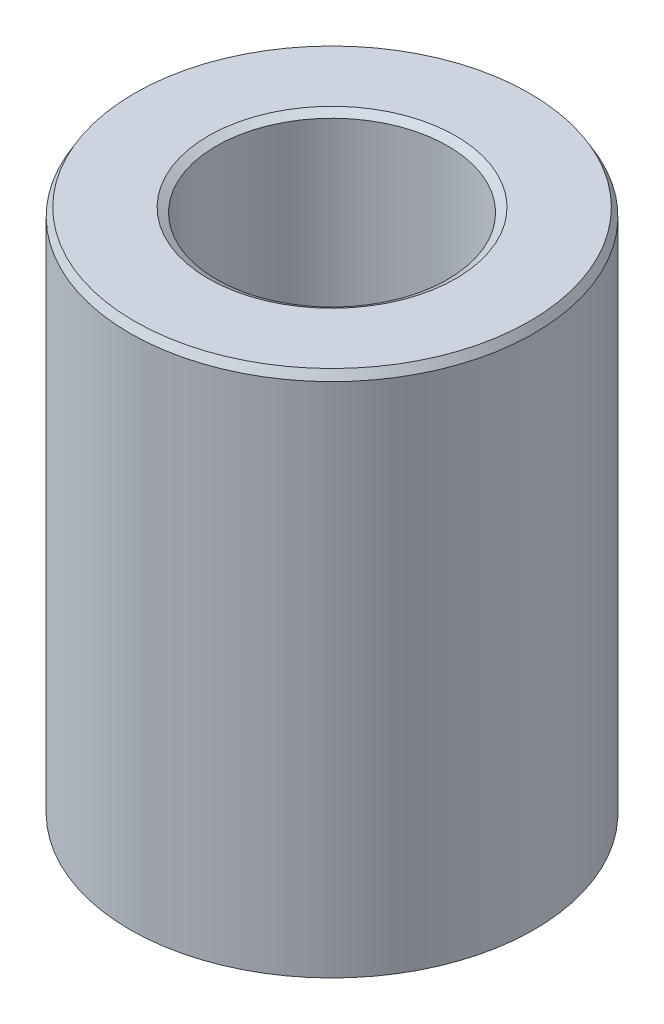
from build123d import *
from OCP.BRepFilletAPI import BRepFilletAPI_MakeChamfer

# Parameters (mm, degrees)
SKETCH1_R           = 35
BOSS_EXTRUDE1_DEPTH = 91.614825625
SKETCH2_R           = 20.023387625
CUT_EXTRUDE1_DEPTH  = 105.131053362
CHAMFER1_SIZE       = 1.395271686
CHAMFER1_SIZE2      = 0.805560484


with BuildPart() as part:
    # Sketch1 → Boss-Extrude1 (new body)
    with BuildSketch(Plane(origin=(0, 0, 0), x_dir=(1, 0, 0), z_dir=(0, 1, 0))):
        Circle(SKETCH1_R)
    extrude(amount=BOSS_EXTRUDE1_DEPTH)

    # Sketch2 → Cut-Extrude1 (cut, through all)
    with BuildSketch(Plane(origin=(0, 0, 0), x_dir=(1, 0, 0), z_dir=(0, 1, 0))):
        Circle(SKETCH2_R)
    extrude(amount=CUT_EXTRUDE1_DEPTH, mode=Mode.SUBTRACT)

    # Chamfer1: one chamfer whose edges measure the first distance from different faces: ONE call of the kernel's chamfer builder (chamfer() names one face for all edges)
    chamfer1_edges_1 = [part.edges().sort_by_distance(p)[0] for p in [
        (-20.023387625, 91.614825625, 0),
    ]]
    chamfer1_side_1 = [part.faces().sort_by_distance(p)[0] for p in [
        (-34.010050506, 91.614825625, 0),
    ]]
    chamfer1_edges_2 = [part.edges().sort_by_distance(p)[0] for p in [
        (-20.023387625, 0, 0),
    ]]
    chamfer1_side_2 = [part.faces().sort_by_distance(p)[0] for p in [
        (-20.023387625, 45.807412813, 0),
    ]]
    chamfer1_edges_3 = [part.edges().sort_by_distance(p)[0] for p in [
        (-35, 0, 0),
    ]]
    chamfer1_side_3 = [part.faces().sort_by_distance(p)[0] for p in [
        (-34.010050506, 0, 0),
    ]]
    chamfer1_edges_4 = [part.edges().sort_by_distance(p)[0] for p in [
        (-35, 91.614825625, 0),
    ]]
    chamfer1_side_4 = [part.faces().sort_by_distance(p)[0] for p in [
        (-35, 45.807412813, 0),
    ]]
    chamfer1 = BRepFilletAPI_MakeChamfer(part.part.solid().wrapped)
    for e in chamfer1_edges_1:
        chamfer1.Add(CHAMFER1_SIZE, CHAMFER1_SIZE2, e.wrapped, chamfer1_side_1[0].wrapped)  # the first distance lies on this face
    for e in chamfer1_edges_2:
        chamfer1.Add(CHAMFER1_SIZE, CHAMFER1_SIZE2, e.wrapped, chamfer1_side_2[0].wrapped)  # the first distance lies on this face
    for e in chamfer1_edges_3:
        chamfer1.Add(CHAMFER1_SIZE, CHAMFER1_SIZE2, e.wrapped, chamfer1_side_3[0].wrapped)  # the first distance lies on this face
    for e in chamfer1_edges_4:
        chamfer1.Add(CHAMFER1_SIZE, CHAMFER1_SIZE2, e.wrapped, chamfer1_side_4[0].wrapped)  # the first distance lies on this face
    add(Compound.cast(chamfer1.Shape()), mode=Mode.REPLACE)


solid = part.part
